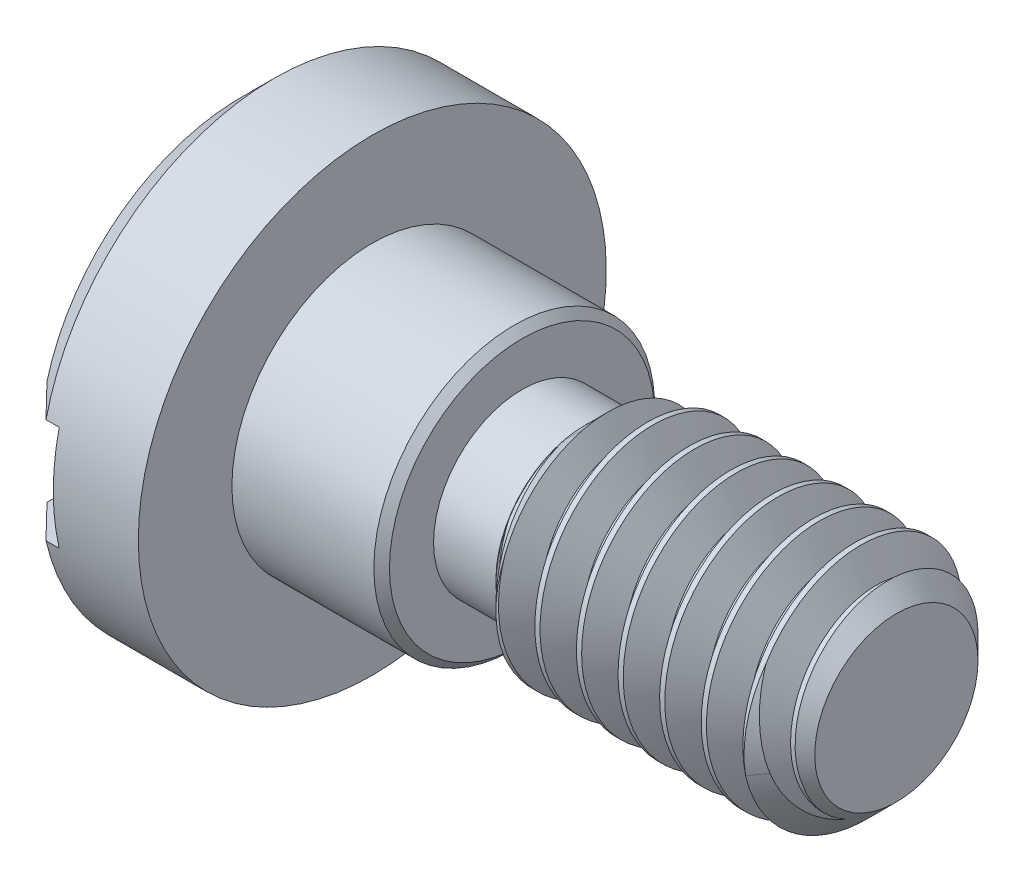
from build123d import *

# Parameters (mm, degrees)
SKETCH2_R               = 3.96875
EXTRUDE1_DEPTH          = 12.7
CHAMFER1_SIZE           = 1.199444444
CUT_SWEEP1_PITCH        = 1.411111111
SKETCH6_R               = 4.7625
EXTRUDE2_DEPTH          = 5.08
SKETCH7_R               = 7.9375
EXTRUDE3_DEPTH          = 4.445
CHAMFER2_SIZE           = 0.264583333
CHAMFER3_SIZE           = 1.11125
SKETCH8_W               = 15.875
SKETCH8_H               = 3.556
CUT_EXTRUDE_THIN1_DEPTH = 1.559277778


with BuildPart() as part:
    # Sketch2 → Extrude1 (new body)
    with BuildSketch(Plane(origin=(11.1125, 0, 0), x_dir=(0, 0, -1), z_dir=(1, 0, 0))):
        Circle(SKETCH2_R)
    extrude(amount=-EXTRUDE1_DEPTH)

    # Chamfer1
    chamfer1_edges = [part.edges().sort_by_distance(p)[0] for p in [
        (11.1125, 0, 3.96875),
    ]]
    chamfer(chamfer1_edges, length=CHAMFER1_SIZE)

    # Cut-Sweep1: the profile of Sketch4 profile screwed along a right-hand helix of 9.5625 turns, 8 arcs to a turn; built about Z, then put on its axis
    cut_sweep1_z = Axis((0, 0, 0), (0, 0, 1))
    cut_sweep1_corners = [(3.96905, 0, -1.234895427), (3.96905, 0, 0.000173205), (3.052206448, 0, -0.529166667), (3.052206448, 0, -0.705555556)]
    with BuildLine(mode=Mode.PRIVATE) as cut_sweep1_profile:
        Line(cut_sweep1_corners[0], cut_sweep1_corners[1])
        Line(cut_sweep1_corners[1], cut_sweep1_corners[2])
        Line(cut_sweep1_corners[2], cut_sweep1_corners[3])
        Line(cut_sweep1_corners[3], cut_sweep1_corners[0])
    cut_sweep1_cap = Face(cut_sweep1_profile.wire())
    cut_sweep1_turn_angles = [0, 22.5, 45, 67.5, 90, 112.5, 135, 157.5, 180, 202.5, 225, 247.5, 270, 292.5, 315, 337.5, 360]
    cut_sweep1_turn_weights = [1, 0.9238795325112867, 1, 0.9238795325112867, 1, 0.9238795325112867, 1, 0.9238795325112867, 1, 0.9238795325112867, 1, 0.9238795325112867, 1, 0.9238795325112867, 1, 0.9238795325112867, 1]
    cut_sweep1_turn_rails = [Edge.make_bspline([Vector(p[0], p[1], 0).rotate(cut_sweep1_z, cut_sweep1_turn_angles[k]) / cut_sweep1_turn_weights[k] + Vector(0, 0, p[2] + CUT_SWEEP1_PITCH * cut_sweep1_turn_angles[k] / 360) for k in range(17)], [0, 0, 0, 1, 1, 2, 2, 3, 3, 4, 4, 5, 5, 6, 6, 7, 7, 8, 8, 8], 2, cut_sweep1_turn_weights) for p in cut_sweep1_corners]
    cut_sweep1_turn_sides = [Face.make_surface_from_curves(cut_sweep1_turn_rails[p[0]], cut_sweep1_turn_rails[p[1]]) for p in [(0, 1), (1, 2), (2, 3), (3, 0)]]
    cut_sweep1_last_angles = [3240, 3262.5, 3285, 3307.5, 3330, 3352.5, 3375, 3397.5, 3420, 3431.25, 3442.5]
    cut_sweep1_last_weights = [1, 0.9238795325112867, 1, 0.9238795325112867, 1, 0.9238795325112867, 1, 0.9238795325112867, 1, 0.9807852804032158, 1]
    cut_sweep1_last_rails = [Edge.make_bspline([Vector(p[0], p[1], 0).rotate(cut_sweep1_z, cut_sweep1_last_angles[k]) / cut_sweep1_last_weights[k] + Vector(0, 0, p[2] + CUT_SWEEP1_PITCH * cut_sweep1_last_angles[k] / 360) for k in range(11)], [0, 0, 0, 1, 1, 2, 2, 3, 3, 4, 4, 5, 5, 5], 2, cut_sweep1_last_weights) for p in cut_sweep1_corners]
    cut_sweep1_last_sides = [Face.make_surface_from_curves(cut_sweep1_last_rails[p[0]], cut_sweep1_last_rails[p[1]]) for p in [(0, 1), (1, 2), (2, 3), (3, 0)]]
    cut_sweep1 = Plane(origin=(11.1125, 0, 0), x_dir=(0, 1, 0), z_dir=(-1, 0, 0)) * Solid(Shell([*[p.moved(Location((0, 0, CUT_SWEEP1_PITCH * i))) for i in range(9) for p in cut_sweep1_turn_sides], *cut_sweep1_last_sides, cut_sweep1_cap, cut_sweep1_cap.rotate(cut_sweep1_z, 3442.5).moved(Location((0, 0, CUT_SWEEP1_PITCH * 3442.5 / 360)))]))
    add(cut_sweep1, mode=Mode.SUBTRACT)

    # Sketch5 → Cut-Revolve1 (revolve, cut)
    with BuildSketch(Plane.XY, mode=Mode.PRIVATE) as cut_revolve1_sk:
        Polygon((-1.5875, 3.96875), (-1.5875, 3.001406448), (0.529166667, 3.001406448), (1.496510219, 3.96875), align=None)
    revolve(cut_revolve1_sk.sketch.rotate(Axis((-11.1125, 0, 0), (1, 0, 0)), 90), axis=Axis((-11.1125, 0, 0), (1, 0, 0)), mode=Mode.SUBTRACT)

    # Sketch6 → Extrude2 (add)
    with BuildSketch(Plane.ZY.offset(1.5875)):
        Circle(SKETCH6_R)
    extrude(amount=EXTRUDE2_DEPTH)

    # Sketch7 → Extrude3 (add)
    with BuildSketch(Plane.ZY.offset(6.6675)):
        Circle(SKETCH7_R)
    extrude(amount=EXTRUDE3_DEPTH)

    # Chamfer2
    chamfer2_edges = [part.edges().sort_by_distance(p)[0] for p in [
        (-1.5875, 0, -4.7625),
    ]]
    chamfer(chamfer2_edges, length=CHAMFER2_SIZE)

    # Chamfer3
    chamfer3_edges = [part.edges().sort_by_distance(p)[0] for p in [
        (-11.1125, 0, -7.9375),
    ]]
    chamfer(chamfer3_edges, length=CHAMFER3_SIZE)

    # Sketch8 → Cut-Extrude-Thin1 (cut)
    with BuildSketch(Plane.ZY.offset(11.1125)):
        Rectangle(SKETCH8_W, SKETCH8_H)
    extrude(amount=-CUT_EXTRUDE_THIN1_DEPTH, mode=Mode.SUBTRACT)


solid = part.part
